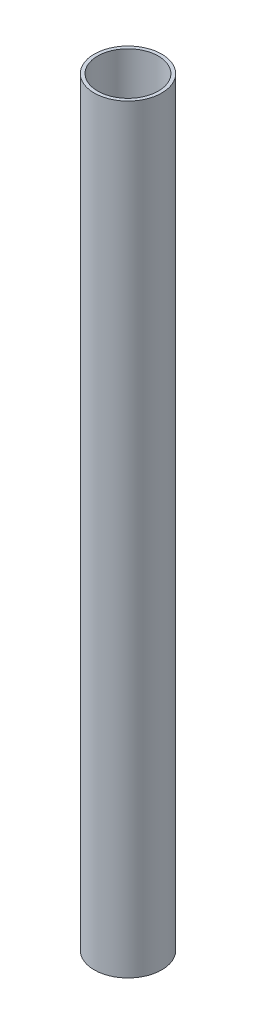
from build123d import *

# Parameters (mm, degrees)
SKETCH1_R           = 10
SKETCH1_R_2         = 9
BOSS_EXTRUDE1_DEPTH = 225


with BuildPart() as part:
    # Sketch1 → Boss-Extrude1 (new body)
    with BuildSketch(Plane(origin=(0, 0, 0), x_dir=(1, 0, 0), z_dir=(0, 1, 0))):
        Circle(SKETCH1_R)
        Circle(SKETCH1_R_2, mode=Mode.SUBTRACT)
    extrude(amount=BOSS_EXTRUDE1_DEPTH)


solid = part.part
